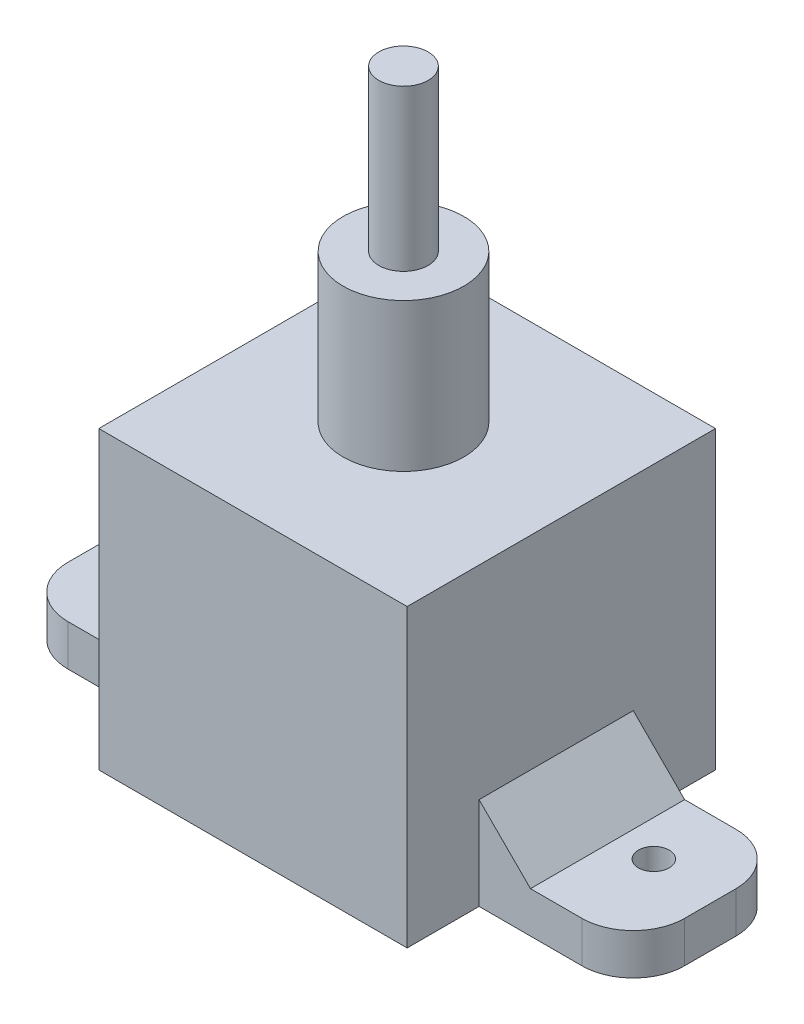
from build123d import *

# Parameters (mm, degrees)
SKETCH_1_W               = 30
SKETCH_1_H               = 30
EXTRUDE_289_DEPTH        = 28.77
SKETCH_2_R               = 5.875
EXTRUDE_2_DEPTH          = 14.4
SKETCH_4_R               = 2.4
EXTRUDE_3_DEPTH          = 15.6
EXTRUDE_4_DEPTH          = 4
CUT_EXTRUDE_2_DEPTH      = 65.644407396
CUT_EXTRUDE_2_DEPTH_BACK = 65.644407396
SKETCH_6_R               = 1.5
CHAMFER_2_SIZE           = 5
CHAMFER_3_SIZE           = 5


with BuildPart() as part:
    # Эскиз1 → Extrude 289 (new body)
    with BuildSketch(Plane(origin=(0, 0, 0), x_dir=(1, 0, 0), z_dir=(0, 1, 0))):
        with Locations((0.713469456, -0.356734728)):
            Rectangle(SKETCH_1_W, SKETCH_1_H)
    extrude(amount=EXTRUDE_289_DEPTH)

    # Эскиз2 → Бобышка-Вытянуть2 (add)
    with BuildSketch(Plane(origin=(0, 28.77, 0), x_dir=(1, 0, 0), z_dir=(0, 1, 0))):
        Circle(SKETCH_2_R)
    extrude(amount=EXTRUDE_2_DEPTH)

    # Эскиз4 → Бобышка-Вытянуть3 (add)
    with BuildSketch(Plane(origin=(0, 43.17, 0), x_dir=(1, 0, 0), z_dir=(0, 1, 0))):
        Circle(SKETCH_4_R)
    extrude(amount=EXTRUDE_3_DEPTH)

    # Эскиз5 → Бобышка-Вытянуть4 (add)
    with BuildSketch(Plane.XZ):
        with BuildLine():
            Line((15.713469456, 8.356734728), (25.713469456, 8.356734728))
            ThreePointArc((25.713469456, 8.356734728), (29.249003362, 6.892268634), (30.713469456, 3.356734728))
            Line((30.713469456, 3.356734728), (30.713469456, -1.643265272))
            ThreePointArc((30.713469456, -1.643265272), (29.249003362, -5.178799178), (25.713469456, -6.643265272))
            Line((25.713469456, -6.643265272), (15.713469456, -6.643265272))
            Line((15.713469456, -6.643265272), (15.713469456, 8.356734728))
        make_face()
        with BuildLine():
            Line((-14.286530544, 8.356734728), (-24.286530544, 8.356734728))
            ThreePointArc((-24.286530544, 8.356734728), (-27.82206445, 6.892268634), (-29.286530544, 3.356734728))
            Line((-29.286530544, 3.356734728), (-29.286530544, -1.643265272))
            ThreePointArc((-29.286530544, -1.643265272), (-27.82206445, -5.178799178), (-24.286530544, -6.643265272))
            Line((-24.286530544, -6.643265272), (-14.286530544, -6.643265272))
            Line((-14.286530544, -6.643265272), (-14.286530544, 8.356734728))
        make_face()
    extrude(amount=-EXTRUDE_4_DEPTH)

    # Эскиз6 → Вырез-Вытянуть2 (cut, two sides: drawn at the far end of the back side and taken through both)
    with BuildSketch(Plane(origin=(0, 4, 0), x_dir=(1, 0, 0), z_dir=(0, 1, 0)).offset(-CUT_EXTRUDE_2_DEPTH_BACK)):
        with Locations((24.213469456, 0.143265272)):
            Circle(SKETCH_6_R)
        with Locations((-22.786530544, 0.143265272)):
            Circle(SKETCH_6_R)
    extrude(amount=CUT_EXTRUDE_2_DEPTH + CUT_EXTRUDE_2_DEPTH_BACK, mode=Mode.SUBTRACT)

    # Фаска2
    chamfer_2_edges = [part.edges().sort_by_distance(p)[0] for p in [
        (15.713469456, 4, 0.856734728),
    ]]
    chamfer(chamfer_2_edges, length=CHAMFER_2_SIZE)

    # Фаска3
    chamfer_3_edges = [part.edges().sort_by_distance(p)[0] for p in [
        (-14.286530544, 4, 0.856734728),
    ]]
    chamfer(chamfer_3_edges, length=CHAMFER_3_SIZE)


solid = part.part
